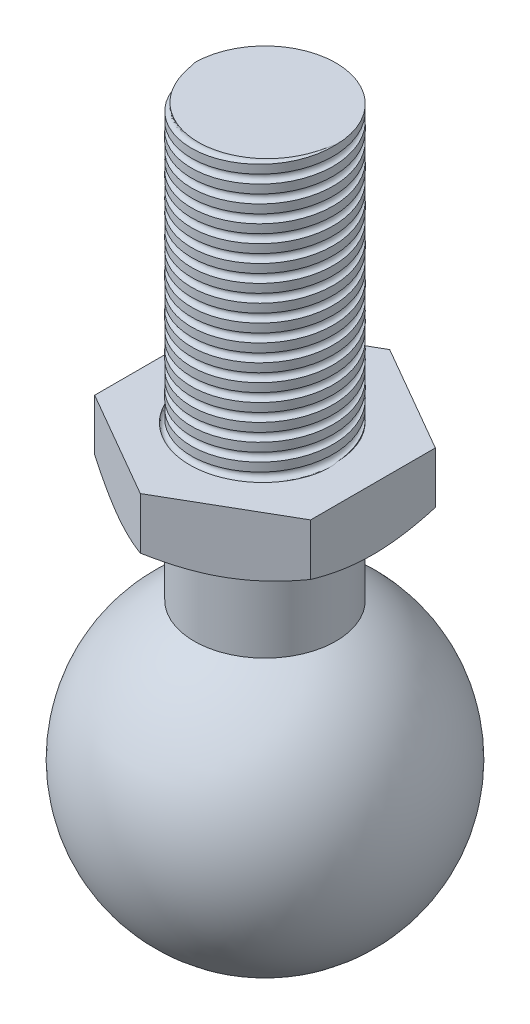
from build123d import *

# Parameters (mm, degrees)
IZIM2_R               = 25
KES_EKSTR_ZYON1_DEPTH = 2
KES_EKSTR_ZYON2_START = -5
KES_EKSTR_ZYON2_DEPTH = 5
KES_S_P_R1_PITCH      = 1


with BuildPart() as part:
    # Çizim1 → Döndür1 (revolve)
    with BuildSketch(Plane(origin=(0, 0, 0), x_dir=(0, 0, -1), z_dir=(1, 0, 0))):
        with BuildLine():
            Line((0, 9), (0, -9))
            ThreePointArc((0, -9), (-9, 0), (0, 9))
        make_face()
    revolve(axis=Axis((0, 9, 0), (0, -1, 0)))

    # Çizim2 → Kes-Ekstrüzyon1 (cut)
    with BuildSketch(Plane(origin=(0, 10, 0), x_dir=(1, 0, 0), z_dir=(0, 1, 0))):
        Circle(IZIM2_R)
    extrude(amount=-KES_EKSTR_ZYON1_DEPTH, mode=Mode.SUBTRACT)

    # Çizim3 → Döndür2 (revolve)
    with BuildSketch(Plane(origin=(0, 0, 0), x_dir=(0, 0, -1), z_dir=(1, 0, 0)), mode=Mode.PRIVATE) as d_nd_r2_sk:
        Polygon((0, 33), (-4.123105626, 33), (-4.123105626, 17), (-7.25, 17), (-7.25, 14), (-4.123105626, 12.194686691), (-4.123105626, 8), (0, 8), align=None)
    revolve(d_nd_r2_sk.sketch.rotate(Axis((0, 8, 0), (0, 1, 0)), 180), axis=Axis((0, 8, 0), (0, 1, 0)))

    # Çizim4 → Kes-Ekstrüzyon2 (cut)
    with BuildSketch(Plane(origin=(0, 17, 0), x_dir=(1, 0, 0), z_dir=(0, 1, 0)).offset(KES_EKSTR_ZYON2_START)):
        with BuildLine():
            ThreePointArc((6.278684177, 3.625), (3.625, 6.278684177), (0, 7.25))
            Line((0, 7.25), (6.278684177, 3.625))
        make_face()
        with BuildLine():
            Line((-6.278684177, 3.625), (0, 7.25))
            ThreePointArc((0, 7.25), (-3.625, 6.278684177), (-6.278684177, 3.625))
        make_face()
        with BuildLine():
            Line((-6.278684177, -3.625), (-6.278684177, 3.625))
            ThreePointArc((-6.278684177, 3.625), (-7.25, 0), (-6.278684177, -3.625))
        make_face()
        with BuildLine():
            ThreePointArc((6.278684177, -3.625), (7.25, 0), (6.278684177, 3.625))
            Line((6.278684177, 3.625), (6.278684177, -3.625))
        make_face()
        with BuildLine():
            Line((0, -7.25), (-6.278684177, -3.625))
            ThreePointArc((-6.278684177, -3.625), (-3.625, -6.278684177), (0, -7.25))
        make_face()
        with BuildLine():
            ThreePointArc((0, -7.25), (3.625, -6.278684177), (6.278684177, -3.625))
            Line((6.278684177, -3.625), (0, -7.25))
        make_face()
    extrude(amount=KES_EKSTR_ZYON2_DEPTH, mode=Mode.SUBTRACT)

    # Kes-Süpür1: arcs per turn and ends read off the stored shape
    # Kes-Süpür1: the profile of Çizim6 screwed along a right-hand helix through 18 turns, 8 arcs to a turn; built about Z, then put on its axis
    kes_s_p_r1_z = Axis((0, 0, 0), (0, 0, 1))
    kes_s_p_r1_corners = [(4.373105626, 0, -1), (4.123105626, 0.009643004, -1.249813956), (3.873105626, 0, -1), (4.123105626, -0.009643004, -0.750186044)]
    with BuildLine(mode=Mode.PRIVATE) as kes_s_p_r1_profile:
        ThreePointArc((4.373105626, 0, -1), (4.299882321, 0.006818634, -1.176645142), (4.123105626, 0.009643004, -1.249813956))
        ThreePointArc((4.123105626, 0.009643004, -1.249813956), (3.94632893, 0.006818634, -1.176645142), (3.873105626, 0, -1))
        ThreePointArc((3.873105626, 0, -1), (3.94632893, -0.006818634, -0.823354858), (4.123105626, -0.009643004, -0.750186044))
        ThreePointArc((4.123105626, -0.009643004, -0.750186044), (4.299882321, -0.006818634, -0.823354858), (4.373105626, 0, -1))
    kes_s_p_r1_cap = Face(kes_s_p_r1_profile.wire())
    kes_s_p_r1_arcs = [((4.373105626, 0, -1), (4.373105626, 0.009643004, -1.249813956), (4.123105626, 0.009643004, -1.249813956), (1, 0.7071067811865476, 1)), ((4.123105626, 0.009643004, -1.249813956), (3.873105626, 0.009643004, -1.249813956), (3.873105626, 0, -1), (1, 0.7071067811865476, 1)), ((3.873105626, 0, -1), (3.873105626, -0.009643004, -0.750186044), (4.123105626, -0.009643004, -0.750186044), (1, 0.7071067811865476, 1)), ((4.123105626, -0.009643004, -0.750186044), (4.373105626, -0.009643004, -0.750186044), (4.373105626, 0, -1), (1, 0.7071067811865476, 1))]  # start, shoulder, end, weights
    kes_s_p_r1_turn_angles = [0, 22.5, 45, 67.5, 90, 112.5, 135, 157.5, 180, 202.5, 225, 247.5, 270, 292.5, 315, 337.5, 360]
    kes_s_p_r1_turn_weights = [1, 0.9238795325112867, 1, 0.9238795325112867, 1, 0.9238795325112867, 1, 0.9238795325112867, 1, 0.9238795325112867, 1, 0.9238795325112867, 1, 0.9238795325112867, 1, 0.9238795325112867, 1]
    kes_s_p_r1_turn_sides = [Face.make_bezier_surface([[Vector(p[j][0], p[j][1], 0).rotate(kes_s_p_r1_z, kes_s_p_r1_turn_angles[2 * i + k]) / kes_s_p_r1_turn_weights[2 * i + k] + Vector(0, 0, p[j][2] + KES_S_P_R1_PITCH * kes_s_p_r1_turn_angles[2 * i + k] / 360) for k in range(3)] for j in range(3)], [[p[3][j] * kes_s_p_r1_turn_weights[2 * i + k] for k in range(3)] for j in range(3)]) for p in kes_s_p_r1_arcs for i in range(8)]
    kes_s_p_r1 = Plane(origin=(0, 33, 0), x_dir=(0, 0, 1), z_dir=(0, -1, 0)) * Solid(Shell([*[p.moved(Location((0, 0, KES_S_P_R1_PITCH * i))) for i in range(18) for p in kes_s_p_r1_turn_sides], kes_s_p_r1_cap, kes_s_p_r1_cap.rotate(kes_s_p_r1_z, 6480).moved(Location((0, 0, KES_S_P_R1_PITCH * 6480 / 360)))]))
    add(kes_s_p_r1, mode=Mode.SUBTRACT)


solid = part.part
